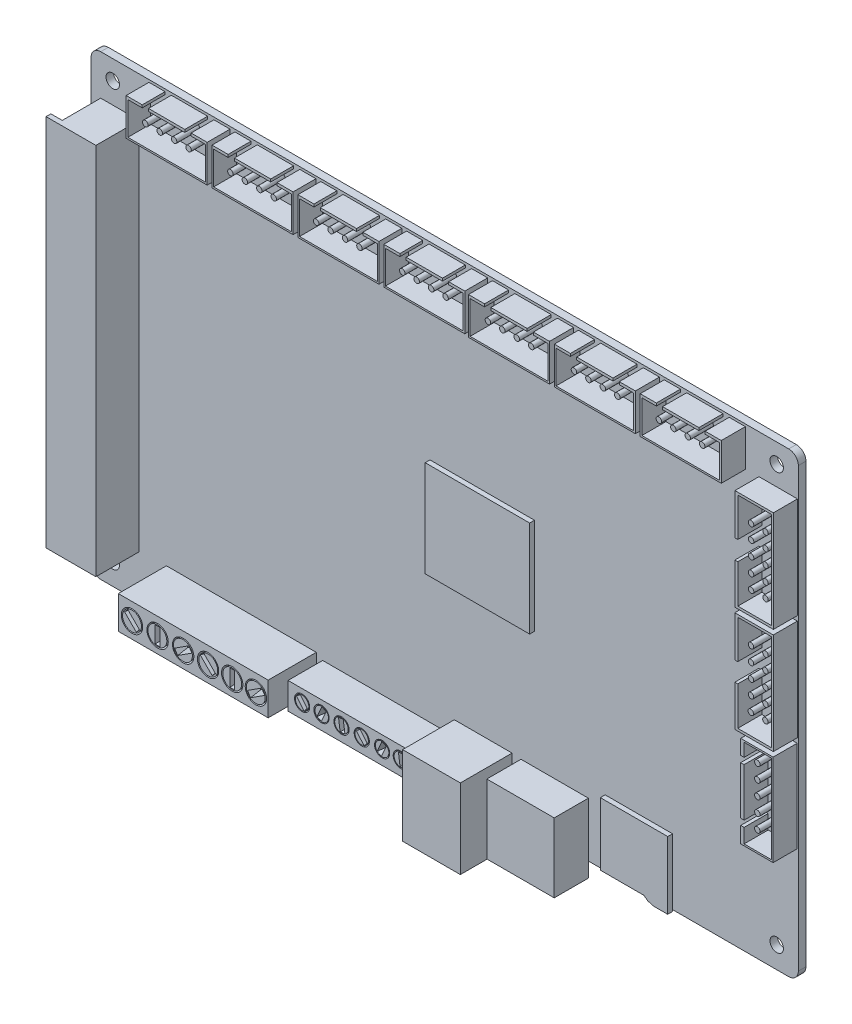
from build123d import *

# Parameters (mm, degrees)
SKETCH3_W                      = 147
SKETCH3_H                      = 95
BOSS_EXTRUDE5_DEPTH            = 1.5748
SKETCH6_R                      = 1.4
CUT_EXTRUDE2_DEPTH             = 1.5748
FILLET6_R                      = 2
SKETCH15_W                     = 21.714963211
SKETCH15_H                     = 19.996512885
BOSS_EXTRUDE10_DEPTH           = 1
SKETCH7_W                      = 12
SKETCH7_H                      = 16.5
BOSS_EXTRUDE6_DEPTH            = 10.75
CUT_EXTRUDE3_DEPTH             = 12
SKETCH9_W                      = 5.5
SKETCH9_H                      = 3.05
BOSS_EXTRUDE7_DEPTH            = 11
SKETCH10_W                     = 14
SKETCH10_H                     = 14.4
BOSS_EXTRUDE8_DEPTH            = 7.1
SKETCH13_W                     = 12.5
SKETCH13_H                     = 5.1
CUT_EXTRUDE4_DEPTH             = 13.1
SKETCH14_W                     = 12
SKETCH14_H                     = 2
BOSS_EXTRUDE9_DEPTH            = 13.1
BOSS_EXTRUDE12_DEPTH           = 1
SKETCH18_W                     = 8.78030315
SKETCH18_H                     = 0.653627585
CUT_EXTRUDE6_DEPTH             = 12
SKETCH20_W                     = 0.622617012
SKETCH20_H                     = 11.966823415
CUT_EXTRUDE10_DEPTH            = 4.2
SKETCH23_W                     = 1.026931474
SKETCH23_H                     = 0.632350711
CUT_EXTRUDE11_DEPTH            = 6.2
SKETCH24_W                     = 1.169082732
SKETCH24_H                     = 0.634351694
CUT_EXTRUDE12_DEPTH            = 7.2
SKETCH25_W                     = 2.917524703
SKETCH25_H                     = 0.634351694
CUT_EXTRUDE13_DEPTH            = 12.2
SKETCH26_W                     = 25.18883357
SKETCH26_H                     = 5.53344525
BOSS_EXTRUDE13_DEPTH           = 7.2
SKETCH27_R                     = 1.580289974
CUT_EXTRUDE15_DEPTH            = 6.2
SKETCH29_W                     = 3.626172381
SKETCH29_H                     = 3.322906905
SKETCH29_W_2                   = 3.774973003
SKETCH29_H_2                   = 3.265151783
SKETCH29_W_3                   = 3.635838499
SKETCH29_H_3                   = 3.35858141
SKETCH29_W_4                   = 3.688227309
SKETCH29_H_4                   = 3.334701193
SKETCH29_W_5                   = 3.579164331
SKETCH29_H_5                   = 3.348359628
SKETCH29_W_6                   = 3.488212318
SKETCH29_H_6                   = 3.383318186
CUT_EXTRUDE18_DEPTH            = 5.2
SKETCH39_R                     = 1.396144904
BOSS_EXTRUDE19_DEPTH           = 6
BOSS_EXTRUDE19_DRAFT           = -2
BOSS_EXTRUDE19_PROFILE_2_DEPTH = 6
BOSS_EXTRUDE19_PROFILE_2_DRAFT = -2
BOSS_EXTRUDE19_PROFILE_3_DEPTH = 6
BOSS_EXTRUDE19_PROFILE_3_DRAFT = -2
BOSS_EXTRUDE19_PROFILE_4_DEPTH = 6
BOSS_EXTRUDE19_PROFILE_4_DRAFT = -2
BOSS_EXTRUDE19_PROFILE_5_DEPTH = 6
BOSS_EXTRUDE19_PROFILE_5_DRAFT = -2
BOSS_EXTRUDE19_PROFILE_6_DEPTH = 6
BOSS_EXTRUDE19_PROFILE_6_DRAFT = -2
SKETCH89_W                     = 3.774973003
SKETCH89_H                     = 2.5316918
BOSS_EXTRUDE42_DEPTH           = 0.001
SKETCH89_W_2                   = 3.626172381
SKETCH89_H_2                   = 2.51724928
BOSS_EXTRUDE42_2_DEPTH         = 0.001
SKETCH89_W_3                   = 3.635838499
SKETCH89_H_3                   = 2.571403021
BOSS_EXTRUDE42_3_DEPTH         = 0.001
SKETCH89_W_4                   = 3.688227309
SKETCH89_H_4                   = 2.531798994
BOSS_EXTRUDE42_4_DEPTH         = 0.001
SKETCH89_W_5                   = 3.579164331
SKETCH89_H_5                   = 2.546927344
BOSS_EXTRUDE42_5_DEPTH         = 0.001
SKETCH89_W_6                   = 3.488212318
SKETCH89_H_6                   = 2.55763813
BOSS_EXTRUDE42_6_DEPTH         = 0.001
CUT_EXTRUDE45_DEPTH            = 2
CUT_EXTRUDE45_DRAFT            = -10
CUT_EXTRUDE45_PROFILE_2_DEPTH  = 2
CUT_EXTRUDE45_PROFILE_2_DRAFT  = -10
CUT_EXTRUDE45_PROFILE_3_DEPTH  = 2
CUT_EXTRUDE45_PROFILE_3_DRAFT  = -10
CUT_EXTRUDE45_PROFILE_4_DEPTH  = 2
CUT_EXTRUDE45_PROFILE_4_DRAFT  = -10
CUT_EXTRUDE45_PROFILE_5_DEPTH  = 2
CUT_EXTRUDE45_PROFILE_5_DRAFT  = -10
CUT_EXTRUDE45_PROFILE_6_DEPTH  = 2
CUT_EXTRUDE45_PROFILE_6_DRAFT  = -10
SKETCH32_W                     = 31.147399156
SKETCH32_H                     = 6.798527249
BOSS_EXTRUDE16_DEPTH           = 10
SKETCH36_R                     = 2.219312114
CUT_EXTRUDE19_DEPTH            = 6
SKETCH37_W                     = 4.373126017
SKETCH37_H                     = 4.272606052
SKETCH37_W_2                   = 4.373126018
SKETCH37_H_2                   = 4.272606053
CUT_EXTRUDE20_DEPTH            = 6
SKETCH38_R                     = 1.962451371
BOSS_EXTRUDE18_DEPTH           = 8.5
BOSS_EXTRUDE18_DRAFT           = -4
BOSS_EXTRUDE18_PROFILE_2_DEPTH = 8.5
BOSS_EXTRUDE18_PROFILE_2_DRAFT = -4
BOSS_EXTRUDE18_PROFILE_3_DEPTH = 8.5
BOSS_EXTRUDE18_PROFILE_3_DRAFT = -4
BOSS_EXTRUDE18_PROFILE_4_DEPTH = 8.5
BOSS_EXTRUDE18_PROFILE_4_DRAFT = -4
BOSS_EXTRUDE18_PROFILE_5_DEPTH = 8.5
BOSS_EXTRUDE18_PROFILE_5_DRAFT = -4
BOSS_EXTRUDE18_PROFILE_6_DEPTH = 8.5
BOSS_EXTRUDE18_PROFILE_6_DRAFT = -4
CUT_EXTRUDE44_DEPTH            = 2
CUT_EXTRUDE44_DRAFT            = -10
SKETCH86_W                     = 1
SKETCH86_H                     = 3.5
CUT_EXTRUDE44_PROFILE_2_DEPTH  = 2
CUT_EXTRUDE44_PROFILE_2_DRAFT  = -10
CUT_EXTRUDE44_PROFILE_3_DEPTH  = 2
CUT_EXTRUDE44_PROFILE_3_DRAFT  = -10
CUT_EXTRUDE44_PROFILE_4_DEPTH  = 2
CUT_EXTRUDE44_PROFILE_4_DRAFT  = -10
CUT_EXTRUDE44_PROFILE_5_DEPTH  = 2
CUT_EXTRUDE44_PROFILE_5_DRAFT  = -10
CUT_EXTRUDE44_PROFILE_6_DEPTH  = 2
CUT_EXTRUDE44_PROFILE_6_DRAFT  = -10
SKETCH87_W                     = 4.373126017
SKETCH87_H                     = 2.977794475
BOSS_EXTRUDE41_DEPTH           = 0.001
SKETCH87_W_2                   = 4.373126018
SKETCH87_H_2                   = 2.991745377
BOSS_EXTRUDE41_2_DEPTH         = 0.001
SKETCH87_H_3                   = 3.006004807
BOSS_EXTRUDE41_3_DEPTH         = 0.001
SKETCH87_H_4                   = 2.982931193
BOSS_EXTRUDE41_4_DEPTH         = 0.001
SKETCH87_W_3                   = 4.358644361
BOSS_EXTRUDE41_5_DEPTH         = 0.001
SKETCH87_H_5                   = 3.041534022
BOSS_EXTRUDE41_6_DEPTH         = 0.001
SKETCH40_W                     = 6.75
SKETCH40_H                     = 19
SKETCH40_W_2                   = 8
SKETCH40_H_2                   = 21
BOSS_EXTRUDE20_DEPTH           = 5
CUT_EXTRUDE24_DEPTH            = 5
SKETCH43_R                     = 0.569055362
BOSS_EXTRUDE23_DEPTH           = 4.75
SKETCH47_W                     = 16.85
SKETCH47_H                     = 7.7
BOSS_EXTRUDE25_DEPTH           = 5
CUT_EXTRUDE26_DEPTH            = 5
SKETCH50_R                     = 0.569055362
BOSS_EXTRUDE26_DEPTH           = 4.75
SKETCH51_W                     = 16.85
SKETCH51_H                     = 7.7
BOSS_EXTRUDE27_DEPTH           = 4.75
CUT_EXTRUDE28_DEPTH            = 4.75
SKETCH53_R                     = 0.569055362
BOSS_EXTRUDE28_DEPTH           = 4.75
SKETCH54_W                     = 16.85
SKETCH54_H                     = 7.7
BOSS_EXTRUDE29_DEPTH           = 4.75
CUT_EXTRUDE29_DEPTH            = 4.75
SKETCH56_R                     = 0.569055362
BOSS_EXTRUDE30_DEPTH           = 4.75
SKETCH60_W                     = 16.85
SKETCH60_H                     = 7.7
BOSS_EXTRUDE32_DEPTH           = 4.75
CUT_EXTRUDE30_DEPTH            = 4.75
SKETCH62_R                     = 0.569055362
BOSS_EXTRUDE33_DEPTH           = 4.75
SKETCH16_W                     = 8
SKETCH16_H                     = 77.642710186
BOSS_EXTRUDE11_DEPTH           = 8
SKETCH64_W                     = 4
SKETCH64_H                     = 8
SKETCH64_W_2                   = 4.033389406
SKETCH64_H_2                   = 8.142710186
SKETCH64_W_3                   = 4.042075951
CUT_EXTRUDE34_DEPTH            = 6.75
SKETCH65_R                     = 2.502700797
CUT_EXTRUDE35_DEPTH            = 3.75
BOSS_EXTRUDE40_DEPTH           = 5
BOSS_EXTRUDE40_DEPTH_BACK      = 1
SKETCH76_R                     = 2.566901317
SKETCH79_R                     = 3.232299172
CUT_EXTRUDE38_DEPTH            = 0.12
CUT_EXTRUDE43_DEPTH            = 2
CUT_EXTRUDE43_DRAFT            = -10
CUT_EXTRUDE43_PROFILE_2_DEPTH  = 2
CUT_EXTRUDE43_PROFILE_2_DRAFT  = -10
CUT_EXTRUDE43_PROFILE_3_DEPTH  = 2
CUT_EXTRUDE43_PROFILE_3_DRAFT  = -10
CUT_EXTRUDE43_PROFILE_4_DEPTH  = 2
CUT_EXTRUDE43_PROFILE_4_DRAFT  = -10
CUT_EXTRUDE43_PROFILE_5_DEPTH  = 2
CUT_EXTRUDE43_PROFILE_5_DRAFT  = -10
CUT_EXTRUDE43_PROFILE_6_DEPTH  = 2
CUT_EXTRUDE43_PROFILE_6_DRAFT  = -10
CUT_EXTRUDE43_PROFILE_7_DEPTH  = 2
CUT_EXTRUDE43_PROFILE_7_DRAFT  = -10
CUT_EXTRUDE43_PROFILE_8_DEPTH  = 2
CUT_EXTRUDE43_PROFILE_8_DRAFT  = -10
SKETCH67_W                     = 10.35593763
SKETCH67_H                     = 77.642710186
BOSS_EXTRUDE35_DEPTH           = 1


with BuildPart() as part:
    # Sketch3 → Boss-Extrude5 (new body)
    with BuildSketch(Plane.XY):
        with Locations((17.207803993, -3.613430127)):
            Rectangle(SKETCH3_W, SKETCH3_H)
    extrude(amount=BOSS_EXTRUDE5_DEPTH)

    # Sketch6 → Cut-Extrude2 (cut)
    with BuildSketch(Plane.XY.offset(1.5748)):
        with Locations((-51.792196007, -46.613430127)):
            Circle(SKETCH6_R)
        with Locations((-51.792196007, 39.886569873)):
            Circle(SKETCH6_R)
        with Locations((86.207803993, -46.613430127)):
            Circle(SKETCH6_R)
        with Locations((86.207803993, 39.886569873)):
            Circle(SKETCH6_R)
    extrude(amount=-CUT_EXTRUDE2_DEPTH, mode=Mode.SUBTRACT)

    # Fillet6
    fillet6_edges = [part.edges().sort_by_distance(p)[0] for p in [
        (-56.292196007, -51.113430127, 0.7874),
        (90.707803993, -51.113430127, 0.7874),
        (-56.292196007, 43.886569873, 0.7874),
        (90.707803993, 43.886569873, 0.7874),
    ]]
    fillet(fillet6_edges, radius=FILLET6_R)

    # Sketch15 → Boss-Extrude10 (add)
    with BuildSketch(Plane.XY.offset(1.5748)):
        with Locations((25.005222369, -5.372433472)):
            Rectangle(SKETCH15_W, SKETCH15_H)
    extrude(amount=BOSS_EXTRUDE10_DEPTH)

    # Sketch7 → Boss-Extrude6 (add)
    with BuildSketch(Plane.XY.offset(1.5748)):
        with Locations((25.207803993, -47.863430127)):
            Rectangle(SKETCH7_W, SKETCH7_H)
    extrude(amount=BOSS_EXTRUDE6_DEPTH)

    # Sketch8 → Cut-Extrude3 (cut)
    with BuildSketch(Plane(origin=(0, -56.113430127, 0), x_dir=(-1, 0, 0), z_dir=(0, -1, 0))):
        Polygon((-22.341878039, -10.675127707), (-27.841878039, -10.675127707), (-29.237343222, -9.201082582), (-29.237343222, -2.895127707), (-20.787343222, -2.895127707), (-20.787343222, -9.20346366), align=None)
    extrude(amount=-CUT_EXTRUDE3_DEPTH, mode=Mode.SUBTRACT)

    # Sketch9 → Boss-Extrude7 (add)
    with BuildSketch(Plane(origin=(0, -44.113430127, 0), x_dir=(-1, 0, 0), z_dir=(0, -1, 0))):
        with Locations((-25.054619289, -6.996187842)):
            Rectangle(SKETCH9_W, SKETCH9_H)
    extrude(amount=BOSS_EXTRUDE7_DEPTH)

    # Sketch10 → Boss-Extrude8 (add)
    with BuildSketch(Plane.XY.offset(1.5748)):
        with Locations((40.064382528, -47.001183299)):
            Rectangle(SKETCH10_W, SKETCH10_H)
    extrude(amount=BOSS_EXTRUDE8_DEPTH)

    # Sketch13 → Cut-Extrude4 (cut)
    with BuildSketch(Plane.XZ.offset(54.201183299)):
        with Locations((40.050984638, 5.17150284)):
            Rectangle(SKETCH13_W, SKETCH13_H)
    extrude(amount=-CUT_EXTRUDE4_DEPTH, mode=Mode.SUBTRACT)

    # Sketch14 → Boss-Extrude9 (add)
    with BuildSketch(Plane.XZ.offset(41.101183299)):
        with Locations((40.088527908, 6.334955429)):
            Rectangle(SKETCH14_W, SKETCH14_H)
    extrude(amount=BOSS_EXTRUDE9_DEPTH)

    # Sketch17 → Boss-Extrude12 (add)
    with BuildSketch(Plane.XY.offset(1.5748)):
        Polygon((50.552999348, -50.518775734), (59.58823747, -50.518775734), (60.425479613, -51.113430127), (61.54180247, -51.460673144), (64.552999348, -51.460673144), (64.552999348, -37.460673144), (50.552999348, -37.460673144), align=None)
    extrude(amount=BOSS_EXTRUDE12_DEPTH)

    # Sketch18 → Cut-Extrude6 (cut)
    with BuildSketch(Plane(origin=(0, -50.518775734, 0), x_dir=(-1, 0, 0), z_dir=(0, -1, 0))):
        with Locations((-55.211638628, -2.067742869)):
            Rectangle(SKETCH18_W, SKETCH18_H)
    extrude(amount=-CUT_EXTRUDE6_DEPTH, mode=Mode.SUBTRACT)

    # Sketch20 → Cut-Extrude10 (cut)
    with BuildSketch(Plane.ZY.offset(-59.601790203)):
        with Locations((2.052237583, -44.535364027)):
            Rectangle(SKETCH20_W, SKETCH20_H)
    extrude(amount=-CUT_EXTRUDE10_DEPTH, mode=Mode.SUBTRACT)

    # Sketch23 → Cut-Extrude11 (cut)
    with BuildSketch(Plane(origin=(-3.869323142, -5.447803689, 0), x_dir=(0.8152853073521378, -0.5790594681168164, 0), z_dir=(-0.5790594681168164, -0.8152853073521378, 0))):
        with Locations((78.348255644, 2.073270127)):
            Rectangle(SKETCH23_W, SKETCH23_H)
    extrude(amount=-CUT_EXTRUDE11_DEPTH, mode=Mode.SUBTRACT)

    # Sketch24 → Cut-Extrude12 (cut)
    with BuildSketch(Plane(origin=(-9.165804948, -29.466388259, 0), x_dir=(0.9548707089079665, -0.2970217656495859, 0), z_dir=(-0.2970217656495858, -0.9548707089079664, 0))):
        with Locations((73.464863185, 2.072269635)):
            Rectangle(SKETCH24_W, SKETCH24_H)
    extrude(amount=-CUT_EXTRUDE12_DEPTH, mode=Mode.SUBTRACT)

    # Sketch25 → Cut-Extrude13 (cut)
    with BuildSketch(Plane.XZ.offset(51.460673144)):
        with Locations((63.000564822, 2.072269635)):
            Rectangle(SKETCH25_W, SKETCH25_H)
    extrude(amount=-CUT_EXTRUDE13_DEPTH, mode=Mode.SUBTRACT)

    # Sketch26 → Boss-Extrude13 (add)
    with BuildSketch(Plane.XY.offset(1.5748)):
        with Locations((4.436304208, -45.387474064)):
            Rectangle(SKETCH26_W, SKETCH26_H)
    extrude(amount=BOSS_EXTRUDE13_DEPTH)

    # Sketch27 → Cut-Extrude15 (cut)
    with BuildSketch(Plane.XY.offset(8.7748)):
        with Locations((-5.236205188, -45.180630643)):
            Circle(SKETCH27_R)
        with Locations((-1.203182391, -45.180630643)):
            Circle(SKETCH27_R)
        with Locations((2.957002854, -45.180630643)):
            Circle(SKETCH27_R)
        with Locations((7.166828426, -45.190844618)):
            Circle(SKETCH27_R)
        with Locations((11.399958297, -45.190844618)):
            Circle(SKETCH27_R)
        with Locations((15.27910638, -45.190844618)):
            Circle(SKETCH27_R)
    extrude(amount=-CUT_EXTRUDE15_DEPTH, mode=Mode.SUBTRACT)

    # Sketch29 → Cut-Extrude18 (cut)
    with BuildSketch(Plane.XZ.offset(48.154196689)):
        with Locations((-1.673951032, 3.494852441)):
            Rectangle(SKETCH29_W, SKETCH29_H)
        with Locations((-5.802030786, 3.538172521)):
            Rectangle(SKETCH29_W_2, SKETCH29_H_2)
        with Locations((2.589908451, 3.531168929)):
            Rectangle(SKETCH29_W_3, SKETCH29_H_3)
        with Locations((6.944386417, 3.503505011)):
            Rectangle(SKETCH29_W_4, SKETCH29_H_4)
        with Locations((11.177948065, 3.517806704)):
            Rectangle(SKETCH29_W_5, SKETCH29_H_5)
        with Locations((15.133000232, 3.511038211)):
            Rectangle(SKETCH29_W_6, SKETCH29_H_6)
    extrude(amount=-CUT_EXTRUDE18_DEPTH, mode=Mode.SUBTRACT)

    # Sketch32 → Boss-Extrude16 (add)
    with BuildSketch(Plane.XY.offset(1.5748)):
        with Locations((-25.060982713, -45.224644901)):
            Rectangle(SKETCH32_W, SKETCH32_H)
    extrude(amount=BOSS_EXTRUDE16_DEPTH)

    # Sketch36 → Cut-Extrude19 (cut)
    with BuildSketch(Plane.XY.offset(11.5748)):
        with Locations((-37.786945298, -45.340307317)):
            Circle(SKETCH36_R)
        with Locations((-32.4689198, -45.340307317)):
            Circle(SKETCH36_R)
        with Locations((-27.155319172, -45.340307317)):
            Circle(SKETCH36_R)
        with Locations((-21.980139946, -45.340307317)):
            Circle(SKETCH36_R)
        with Locations((-16.966134997, -45.340307317)):
            Circle(SKETCH36_R)
        with Locations((-12.037559721, -45.340307317)):
            Circle(SKETCH36_R)
    extrude(amount=-CUT_EXTRUDE19_DEPTH, mode=Mode.SUBTRACT)

    # Sketch37 → Cut-Extrude20 (cut)
    with BuildSketch(Plane.XZ.offset(48.623908526)):
        with Locations((-38.038169002, 4.127758815)):
            Rectangle(SKETCH37_W, SKETCH37_H)
        with Locations((-32.509514199, 4.141709717)):
            Rectangle(SKETCH37_W_2, SKETCH37_H_2)
        with Locations((-27.273667393, 4.155969147)):
            Rectangle(SKETCH37_W, SKETCH37_H_2)
        with Locations((-22.108498903, 4.132895533)):
            Rectangle(SKETCH37_W_2, SKETCH37_H)
        with Locations((-17.022603907, 4.180710001)):
            Rectangle(SKETCH37_W, SKETCH37_H_2)
        with Locations((-12.085754086, 4.191498361)):
            Rectangle(SKETCH37_W, SKETCH37_H_2)
    extrude(amount=-CUT_EXTRUDE20_DEPTH, mode=Mode.SUBTRACT)

    # Sketch40 → Boss-Extrude20 (add)
    with BuildSketch(Plane.XY.offset(1.5748)):
        with Locations((87.096852091, -17.70353017)):
            Rectangle(SKETCH40_W, SKETCH40_H)
        with Locations((86.501077821, 3.29646983)):
            Rectangle(SKETCH40_W_2, SKETCH40_H_2)
        with Locations((86.522761757, 25.29646983)):
            Rectangle(SKETCH40_W_2, SKETCH40_H_2)
    extrude(amount=BOSS_EXTRUDE20_DEPTH)

    # Sketch41 → Cut-Extrude24 (cut)
    with BuildSketch(Plane.XY.offset(6.5748)):
        Polygon((83.129429206, 23.29646983), (83.129429206, 15.29646983), (90.172761757, 15.29646983), (90.172761757, 35.29646983), (83.129429206, 35.29646983), (83.129429206, 27.29646983), (82.522761757, 27.29646983), (82.522761757, 23.29646983), align=None)
        Polygon((83.115428928, 1.29646983), (83.115428928, -6.70353017), (90.151077821, -6.70353017), (90.151077821, 13.29646983), (83.115428928, 13.29646983), (83.115428928, 5.29646983), (82.501077821, 5.29646983), (82.501077821, 1.29646983), align=None)
        Polygon((84.429811691, -23.876456255), (84.429811691, -26.85353017), (90.121852091, -26.85353017), (90.121852091, -8.55353017), (84.429811691, -8.55353017), (84.429811691, -11.276456255), (83.721852091, -11.276456255), (83.721852091, -12.576456255), (84.429811691, -12.576456255), (84.429811691, -22.576456255), (83.721852091, -22.576456255), (83.721852091, -23.876456255), align=None)
    extrude(amount=-CUT_EXTRUDE24_DEPTH, mode=Mode.SUBTRACT)

    # Sketch43 → Boss-Extrude23 (add)
    with BuildSketch(Plane.XY.offset(1.5748)):
        with Locations((86.929811691, -23.187850823)):
            Circle(SKETCH43_R)
        with Locations((86.929811691, -20.187850823)):
            Circle(SKETCH43_R)
        with Locations((86.929811691, -14.187850823)):
            Circle(SKETCH43_R)
        with Locations((86.929811691, -17.187850823)):
            Circle(SKETCH43_R)
        with Locations((86.929811691, -11.187850823)):
            Circle(SKETCH43_R)
        with Locations((85.571686069, -2.70353017)):
            Circle(SKETCH43_R)
        with Locations((85.615428928, 0.29646983)):
            Circle(SKETCH43_R)
        with Locations((85.615428928, 6.29646983)):
            Circle(SKETCH43_R)
        with Locations((85.615428928, 3.29646983)):
            Circle(SKETCH43_R)
        with Locations((85.615428928, 9.29646983)):
            Circle(SKETCH43_R)
        with Locations((88.615428928, -2.70353017)):
            Circle(SKETCH43_R)
        with Locations((88.615428928, 0.29646983)):
            Circle(SKETCH43_R)
        with Locations((88.615428928, 6.29646983)):
            Circle(SKETCH43_R)
        with Locations((88.615428928, 3.29646983)):
            Circle(SKETCH43_R)
        with Locations((88.615428928, 9.29646983)):
            Circle(SKETCH43_R)
        with Locations((85.629429206, 19.29646983)):
            Circle(SKETCH43_R)
        with Locations((85.629429206, 22.29646983)):
            Circle(SKETCH43_R)
        with Locations((85.629429206, 28.29646983)):
            Circle(SKETCH43_R)
        with Locations((85.629429206, 25.322432956)):
            Circle(SKETCH43_R)
        with Locations((85.629429206, 31.29646983)):
            Circle(SKETCH43_R)
        with Locations((88.629429206, 19.29646983)):
            Circle(SKETCH43_R)
        with Locations((88.629429206, 22.29646983)):
            Circle(SKETCH43_R)
        with Locations((88.629429206, 28.29646983)):
            Circle(SKETCH43_R)
        with Locations((88.629429206, 25.29646983)):
            Circle(SKETCH43_R)
        with Locations((88.629429206, 31.29646983)):
            Circle(SKETCH43_R)
    extrude(amount=BOSS_EXTRUDE23_DEPTH)

    # Sketch47 → Boss-Extrude25 (add)
    with BuildSketch(Plane.XY.offset(1.5748)):
        with Locations((53.412979373, 39.536569873)):
            Rectangle(SKETCH47_W, SKETCH47_H)
        with Locations((35.562979373, 39.536569873)):
            Rectangle(SKETCH47_W, SKETCH47_H)
        with Locations((71.262979373, 39.536569873)):
            Rectangle(SKETCH47_W, SKETCH47_H)
    extrude(amount=BOSS_EXTRUDE25_DEPTH)

    # Sketch48 → Cut-Extrude26 (cut)
    with BuildSketch(Plane.XY.offset(6.5748)):
        Polygon((27.487979373, 36.036569873), (43.637979373, 36.036569873), (43.637979373, 42.836569873), (40.637979373, 42.836569873), (40.637979373, 43.386569873), (39.337979373, 43.386569873), (39.337979373, 42.836569873), (31.787979373, 42.836569873), (31.787979373, 43.386569873), (30.487979373, 43.386569873), (30.487979373, 42.836569873), (27.487979373, 42.836569873), align=None)
        Polygon((45.337979373, 36.036569873), (61.487979373, 36.036569873), (61.487979373, 42.836569873), (58.487979373, 42.836569873), (58.487979373, 43.386569873), (57.187979373, 43.386569873), (57.187979373, 42.836569873), (49.637979373, 42.836569873), (49.637979373, 43.386569873), (48.337979373, 43.386569873), (48.337979373, 42.836569873), (45.337979373, 42.836569873), align=None)
        Polygon((63.189047262, 36.036569873), (79.337979373, 36.036569873), (79.337979373, 42.836569873), (76.337979373, 42.836569873), (76.337979373, 43.386569873), (75.037979373, 43.386569873), (75.037979373, 42.836569873), (67.489047262, 42.836569873), (67.489047262, 43.386569873), (66.189047262, 43.386569873), (66.189047262, 42.836569873), (63.189047262, 42.836569873), align=None)
    extrude(amount=-CUT_EXTRUDE26_DEPTH, mode=Mode.SUBTRACT)

    # Sketch50 → Boss-Extrude26 (add)
    with BuildSketch(Plane.XY.offset(1.5748)):
        with Locations((69.466938241, 40.336869119)):
            Circle(SKETCH50_R)
        with Locations((66.466938256, 40.337168365)):
            Circle(SKETCH50_R)
        with Locations((72.466938226, 40.336569873)):
            Circle(SKETCH50_R)
        with Locations((75.466938226, 40.337707496)):
            Circle(SKETCH50_R)
        with Locations((51.819227733, 40.336569873)):
            Circle(SKETCH50_R)
        with Locations((48.819227733, 40.336569873)):
            Circle(SKETCH50_R)
        with Locations((54.819227733, 40.336569873)):
            Circle(SKETCH50_R)
        with Locations((57.819227733, 40.336569873)):
            Circle(SKETCH50_R)
        with Locations((33.926238974, 40.336569873)):
            Circle(SKETCH50_R)
        with Locations((30.926238974, 40.336569873)):
            Circle(SKETCH50_R)
        with Locations((36.926238974, 40.336569873)):
            Circle(SKETCH50_R)
        with Locations((39.926238974, 40.336569873)):
            Circle(SKETCH50_R)
    extrude(amount=BOSS_EXTRUDE26_DEPTH)

    # Sketch51 → Boss-Extrude27 (add)
    with BuildSketch(Plane.XY.offset(1.5748)):
        with Locations((-0.137020627, 39.536569873)):
            Rectangle(SKETCH51_W, SKETCH51_H)
        with Locations((17.712979373, 39.536569873)):
            Rectangle(SKETCH51_W, SKETCH51_H)
    extrude(amount=BOSS_EXTRUDE27_DEPTH)

    # Sketch52 → Cut-Extrude28 (cut)
    with BuildSketch(Plane.XY.offset(6.3248)):
        Polygon((-8.212020627, 36.036569873), (7.937979373, 36.036569873), (7.937979373, 42.836569873), (4.937979373, 42.836569873), (4.937979373, 43.386569873), (3.637979373, 43.386569873), (3.637979373, 42.836569873), (-3.912020627, 42.836569873), (-3.912020627, 43.386569873), (-5.212020627, 43.386569873), (-5.212020627, 42.836569873), (-8.212020627, 42.836569873), align=None)
        Polygon((9.637979373, 36.036569873), (25.786911483, 36.036569873), (25.786911483, 42.836569873), (22.786911483, 42.836569873), (22.786911483, 43.489712014), (21.486911483, 43.489712014), (21.486911483, 42.836569873), (13.937979373, 42.836569873), (13.937979373, 43.489712014), (12.637979373, 43.489712014), (12.637979373, 42.836569873), (9.637979373, 42.836569873), align=None)
    extrude(amount=-CUT_EXTRUDE28_DEPTH, mode=Mode.SUBTRACT)

    # Sketch53 → Boss-Extrude28 (add)
    with BuildSketch(Plane.XY.offset(1.5748)):
        with Locations((16.130464152, 40.336569873)):
            Circle(SKETCH53_R)
        with Locations((13.130464152, 40.336569873)):
            Circle(SKETCH53_R)
        with Locations((19.130464152, 40.336569873)):
            Circle(SKETCH53_R)
        with Locations((22.130464152, 40.336569873)):
            Circle(SKETCH53_R)
        with Locations((-1.762524607, 40.336569873)):
            Circle(SKETCH53_R)
        with Locations((-4.762524607, 40.336569873)):
            Circle(SKETCH53_R)
        with Locations((1.237475393, 40.336569873)):
            Circle(SKETCH53_R)
        with Locations((4.237475393, 40.336569873)):
            Circle(SKETCH53_R)
    extrude(amount=BOSS_EXTRUDE28_DEPTH)

    # Sketch54 → Boss-Extrude29 (add)
    with BuildSketch(Plane.XY.offset(1.5748)):
        with Locations((-17.987020627, 39.536569873)):
            Rectangle(SKETCH54_W, SKETCH54_H)
    extrude(amount=BOSS_EXTRUDE29_DEPTH)

    # Sketch55 → Cut-Extrude29 (cut)
    with BuildSketch(Plane.XY.offset(6.3248)):
        Polygon((-26.062020627, 36.036569873), (-9.912020627, 36.036569873), (-9.912020627, 42.836569873), (-12.912020627, 42.836569873), (-12.912020627, 43.386569873), (-14.212020627, 43.386569873), (-14.212020627, 42.836569873), (-21.762020627, 42.836569873), (-21.762020627, 43.386569873), (-23.062020627, 43.386569873), (-23.062020627, 42.836569873), (-26.062020627, 42.836569873), align=None)
    extrude(amount=-CUT_EXTRUDE29_DEPTH, mode=Mode.SUBTRACT)

    # Sketch56 → Boss-Extrude30 (add)
    with BuildSketch(Plane.XY.offset(1.5748)):
        with Locations((-19.580399491, 40.336569873)):
            Circle(SKETCH56_R)
        with Locations((-22.580399491, 40.336569873)):
            Circle(SKETCH56_R)
        with Locations((-16.580399491, 40.336569873)):
            Circle(SKETCH56_R)
        with Locations((-13.580399491, 40.336569873)):
            Circle(SKETCH56_R)
    extrude(amount=BOSS_EXTRUDE30_DEPTH)

    # Sketch60 → Boss-Extrude32 (add)
    with BuildSketch(Plane.XY.offset(1.5748)):
        with Locations((-35.837020627, 39.536569873)):
            Rectangle(SKETCH60_W, SKETCH60_H)
    extrude(amount=BOSS_EXTRUDE32_DEPTH)

    # Sketch61 → Cut-Extrude30 (cut)
    with BuildSketch(Plane.XY.offset(6.3248)):
        Polygon((-43.912020627, 36.036569873), (-27.762020627, 36.036569873), (-27.762020627, 42.836569873), (-30.762020627, 42.836569873), (-30.762020627, 43.386569873), (-32.062020627, 43.386569873), (-32.062020627, 42.836569873), (-39.612020627, 42.836569873), (-39.612020627, 43.386569873), (-40.912020627, 43.386569873), (-40.912020627, 42.836569873), (-43.912020627, 42.836569873), align=None)
    extrude(amount=-CUT_EXTRUDE30_DEPTH, mode=Mode.SUBTRACT)

    # Sketch62 → Boss-Extrude33 (add)
    with BuildSketch(Plane.XY.offset(1.5748)):
        with Locations((-37.281131474, 40.336569873)):
            Circle(SKETCH62_R)
        with Locations((-40.281131474, 40.336569873)):
            Circle(SKETCH62_R)
        with Locations((-34.281131474, 40.336569873)):
            Circle(SKETCH62_R)
        with Locations((-31.281131474, 40.336569873)):
            Circle(SKETCH62_R)
    extrude(amount=BOSS_EXTRUDE33_DEPTH)

    # Sketch16 → Boss-Extrude11 (add)
    with BuildSketch(Plane.XY.offset(1.5748)):
        with Locations((-50.292196007, -3.301420503)):
            Rectangle(SKETCH16_W, SKETCH16_H)
    extrude(amount=BOSS_EXTRUDE11_DEPTH)

    # Sketch64 → Cut-Extrude34 (cut)
    with BuildSketch(Plane.ZY.offset(54.292196007)):
        with Locations((7.5748, 30.01993459)):
            Rectangle(SKETCH64_W, SKETCH64_H)
        with Locations((7.5748, 20.51993459)):
            Rectangle(SKETCH64_W, SKETCH64_H)
        with Locations((7.5748, 11.01993459)):
            Rectangle(SKETCH64_W, SKETCH64_H)
        with Locations((7.5748, 1.51993459)):
            Rectangle(SKETCH64_W, SKETCH64_H)
        with Locations((7.5748, -7.98006541)):
            Rectangle(SKETCH64_W, SKETCH64_H)
        with Locations((7.558105297, -27.051420503)):
            Rectangle(SKETCH64_W_2, SKETCH64_H_2)
        with Locations((7.5748, -17.48006541)):
            Rectangle(SKETCH64_W, SKETCH64_H)
        with Locations((7.553762025, -36.622775596)):
            Rectangle(SKETCH64_W_3, SKETCH64_H)
    extrude(amount=-CUT_EXTRUDE34_DEPTH, mode=Mode.SUBTRACT)

    # Sketch65 → Cut-Extrude35 (cut)
    with BuildSketch(Plane.XY.offset(5.5748)):
        with Locations((-50.888201122, 30.025480468)):
            Circle(SKETCH65_R)
        with Locations((-50.917196007, 20.51993459)):
            Circle(SKETCH65_R)
        with Locations((-50.917196007, 11.01993459)):
            Circle(SKETCH65_R)
        with Locations((-50.917196007, 1.51993459)):
            Circle(SKETCH65_R)
        with Locations((-50.917196007, -7.98006541)):
            Circle(SKETCH65_R)
        with Locations((-50.917196007, -17.48006541)):
            Circle(SKETCH65_R)
        with Locations((-50.945882935, -26.8958285)):
            Circle(SKETCH65_R)
        with Locations((-50.917196007, -36.602495549)):
            Circle(SKETCH65_R)
    extrude(amount=-CUT_EXTRUDE35_DEPTH, mode=Mode.SUBTRACT)

    # Sketch76 → Boss-Extrude40 (add, two sides: drawn at the far end of the back side and taken through both)
    with BuildSketch(Plane.XY.offset(1.8248).offset(-BOSS_EXTRUDE40_DEPTH_BACK)):
        with Locations((-51.030437086, 20.456489521)):
            Circle(SKETCH76_R)
        with Locations((-51.030437086, 29.951544237)):
            Circle(SKETCH76_R)
        with Locations((-51.030437086, 11.142721318)):
            Circle(SKETCH76_R)
        with Locations((-50.917196007, 1.51993459)):
            Circle(SKETCH76_R)
        with Locations((-50.917196007, -7.935369871)):
            Circle(SKETCH76_R)
        with Locations((-50.945882935, -17.414738342)):
            Circle(SKETCH76_R)
        with Locations((-50.945882935, -26.8958285)):
            Circle(SKETCH76_R)
        with Locations((-50.917196007, -36.602495549)):
            Circle(SKETCH76_R)
    extrude(amount=BOSS_EXTRUDE40_DEPTH + BOSS_EXTRUDE40_DEPTH_BACK)

    # Sketch79 → Cut-Extrude38 (cut)
    with BuildSketch(Plane.XY.offset(5.5748)):
        with Locations((-50.879896867, 20.467643773)):
            Circle(SKETCH79_R)
        with Locations((-50.849079855, 29.974418889)):
            Circle(SKETCH79_R)
        with Locations((-50.879896867, 11.284641479)):
            Circle(SKETCH79_R)
        with Locations((-50.8958665, 1.545637911)):
            Circle(SKETCH79_R)
        with Locations((-50.817068655, -7.901236898)):
            Circle(SKETCH79_R)
        with Locations((-50.82040226, -17.398306067)):
            Circle(SKETCH79_R)
        with Locations((-50.792196317, -26.805946795)):
            Circle(SKETCH79_R)
        with Locations((-51.067841233, -36.516131082)):
            Circle(SKETCH79_R)
    extrude(amount=CUT_EXTRUDE38_DEPTH, mode=Mode.SUBTRACT)


with BuildPart() as body_2:
    # Sketch39 → Boss-Extrude19 (with draft: the straight prism first)
    with BuildSketch(Plane.XY.offset(8.7748)):
        with Locations((-5.236205188, -45.180630643)):
            Circle(SKETCH39_R)
    extrude(amount=-BOSS_EXTRUDE19_DEPTH)
    # Boss-Extrude19: the draft: its side faces are tilted about the plane it starts from
    boss_extrude19_sides = [body_2.faces().sort_by_distance(p)[0] for p in [
        (-6.632350093, -45.180630643, 5.7748),
    ]]
    draft(boss_extrude19_sides, Plane.XY.offset(8.7748), BOSS_EXTRUDE19_DRAFT)


with BuildPart() as body_3:
    # Sketch39 → Boss-Extrude19 profile 2 (with draft: the straight prism first)
    with BuildSketch(Plane.XY.offset(8.7748)):
        with Locations((-1.159265502, -45.180630643)):
            Circle(SKETCH39_R)
    extrude(amount=-BOSS_EXTRUDE19_PROFILE_2_DEPTH)
    # Boss-Extrude19 profile 2: the draft: its side faces are tilted about the plane it starts from
    boss_extrude19_profile_2_sides = [body_3.faces().sort_by_distance(p)[0] for p in [
        (-2.555410406, -45.180630643, 5.7748),
    ]]
    draft(boss_extrude19_profile_2_sides, Plane.XY.offset(8.7748), BOSS_EXTRUDE19_PROFILE_2_DRAFT)


with BuildPart() as body_4:
    # Sketch39 → Boss-Extrude19 profile 3 (with draft: the straight prism first)
    with BuildSketch(Plane.XY.offset(8.7748)):
        with Locations((2.941479821, -45.180630643)):
            Circle(SKETCH39_R)
    extrude(amount=-BOSS_EXTRUDE19_PROFILE_3_DEPTH)
    # Boss-Extrude19 profile 3: the draft: its side faces are tilted about the plane it starts from
    boss_extrude19_profile_3_sides = [body_4.faces().sort_by_distance(p)[0] for p in [
        (1.545334917, -45.180630643, 5.7748),
    ]]
    draft(boss_extrude19_profile_3_sides, Plane.XY.offset(8.7748), BOSS_EXTRUDE19_PROFILE_3_DRAFT)


with BuildPart() as body_5:
    # Sketch39 → Boss-Extrude19 profile 4 (with draft: the straight prism first)
    with BuildSketch(Plane.XY.offset(8.7748)):
        with Locations((7.149512166, -45.180630643)):
            Circle(SKETCH39_R)
    extrude(amount=-BOSS_EXTRUDE19_PROFILE_4_DEPTH)
    # Boss-Extrude19 profile 4: the draft: its side faces are tilted about the plane it starts from
    boss_extrude19_profile_4_sides = [body_5.faces().sort_by_distance(p)[0] for p in [
        (5.753367261, -45.180630643, 5.7748),
    ]]
    draft(boss_extrude19_profile_4_sides, Plane.XY.offset(8.7748), BOSS_EXTRUDE19_PROFILE_4_DRAFT)


with BuildPart() as body_6:
    # Sketch39 → Boss-Extrude19 profile 5 (with draft: the straight prism first)
    with BuildSketch(Plane.XY.offset(8.7748)):
        with Locations((11.402389847, -45.180630643)):
            Circle(SKETCH39_R)
    extrude(amount=-BOSS_EXTRUDE19_PROFILE_5_DEPTH)
    # Boss-Extrude19 profile 5: the draft: its side faces are tilted about the plane it starts from
    boss_extrude19_profile_5_sides = [body_6.faces().sort_by_distance(p)[0] for p in [
        (10.006244943, -45.180630643, 5.7748),
    ]]
    draft(boss_extrude19_profile_5_sides, Plane.XY.offset(8.7748), BOSS_EXTRUDE19_PROFILE_5_DRAFT)


with BuildPart() as body_7:
    # Sketch39 → Boss-Extrude19 profile 6 (with draft: the straight prism first)
    with BuildSketch(Plane.XY.offset(8.7748)):
        with Locations((15.290689545, -45.180630643)):
            Circle(SKETCH39_R)
    extrude(amount=-BOSS_EXTRUDE19_PROFILE_6_DEPTH)
    # Boss-Extrude19 profile 6: the draft: its side faces are tilted about the plane it starts from
    boss_extrude19_profile_6_sides = [body_7.faces().sort_by_distance(p)[0] for p in [
        (13.894544641, -45.180630643, 5.7748),
    ]]
    draft(boss_extrude19_profile_6_sides, Plane.XY.offset(8.7748), BOSS_EXTRUDE19_PROFILE_6_DRAFT)


with BuildPart() as body_8:
    # Sketch89 → Boss-Extrude42 (new body)
    with BuildSketch(Plane.XZ.offset(48.154196689)):
        with Locations((-5.802030786, 3.904902513)):
            Rectangle(SKETCH89_W, SKETCH89_H)
    extrude(amount=BOSS_EXTRUDE42_DEPTH)


with BuildPart() as body_9:
    # Sketch89 → Boss-Extrude42 2 (new body)
    with BuildSketch(Plane.XZ.offset(48.154196689)):
        with Locations((-1.673951032, 3.897681253)):
            Rectangle(SKETCH89_W_2, SKETCH89_H_2)
    extrude(amount=BOSS_EXTRUDE42_2_DEPTH)


with BuildPart() as body_10:
    # Sketch89 → Boss-Extrude42 3 (new body)
    with BuildSketch(Plane.XZ.offset(48.154196689)):
        with Locations((2.589908451, 3.924758124)):
            Rectangle(SKETCH89_W_3, SKETCH89_H_3)
    extrude(amount=BOSS_EXTRUDE42_3_DEPTH)


with BuildPart() as body_11:
    # Sketch89 → Boss-Extrude42 4 (new body)
    with BuildSketch(Plane.XZ.offset(48.154196689)):
        with Locations((6.944386417, 3.90495611)):
            Rectangle(SKETCH89_W_4, SKETCH89_H_4)
    extrude(amount=BOSS_EXTRUDE42_4_DEPTH)


with BuildPart() as body_12:
    # Sketch89 → Boss-Extrude42 5 (new body)
    with BuildSketch(Plane.XZ.offset(48.154196689)):
        with Locations((11.177948065, 3.918522846)):
            Rectangle(SKETCH89_W_5, SKETCH89_H_5)
    extrude(amount=BOSS_EXTRUDE42_5_DEPTH)


with BuildPart() as body_13:
    # Sketch89 → Boss-Extrude42 6 (new body)
    with BuildSketch(Plane.XZ.offset(48.154196689)):
        with Locations((15.133000232, 3.923878239)):
            Rectangle(SKETCH89_W_6, SKETCH89_H_6)
    extrude(amount=BOSS_EXTRUDE42_6_DEPTH)


with BuildPart() as cut_extrude45_tool:
    # Sketch88 → Cut-Extrude45 (with draft: the straight prism first)
    with BuildSketch(Plane.XY.offset(8.7748)):
        Polygon((-6.414629007, -44.524892857), (-4.817337548, -46.448082914), (-4.048061525, -45.809166331), (-5.645352984, -43.885976274), align=None)
    extrude(amount=-CUT_EXTRUDE45_DEPTH)
    # Cut-Extrude45: the draft: its side faces are tilted about the plane it starts from
    cut_extrude45_sides = [cut_extrude45_tool.faces().sort_by_distance(p)[0] for p in [
        (-5.615983278, -45.486487886, 7.7748),
        (-4.432699537, -46.128624623, 7.7748),
        (-4.846707255, -44.847571302, 7.7748),
        (-6.029990995, -44.205434565, 7.7748),
    ]]
    draft(cut_extrude45_sides, Plane.XY.offset(8.7748), CUT_EXTRUDE45_DRAFT)


with BuildPart() as body_2_1:
    add(body_2.part)

    # Cut-Extrude45: cut by cut_extrude45_tool
    add(cut_extrude45_tool.part, mode=Mode.SUBTRACT)


with BuildPart() as cut_extrude45_profile_2_tool:
    # Sketch88 → Cut-Extrude45 profile 2 (with draft: the straight prism first)
    with BuildSketch(Plane.XY.offset(8.7748)):
        Polygon((2.32570159, -44.017304383), (2.673634343, -46.492974555), (3.663902411, -46.353801454), (3.315969659, -43.878131282), align=None)
    extrude(amount=-CUT_EXTRUDE45_PROFILE_2_DEPTH)
    # Cut-Extrude45 profile 2: the draft: its side faces are tilted about the plane it starts from
    cut_extrude45_profile_2_sides = [cut_extrude45_profile_2_tool.faces().sort_by_distance(p)[0] for p in [
        (2.499667967, -45.255139469, 7.7748),
        (3.168768377, -46.423388005, 7.7748),
        (3.489936035, -45.115966368, 7.7748),
        (2.820835625, -43.947717833, 7.7748),
    ]]
    draft(cut_extrude45_profile_2_sides, Plane.XY.offset(8.7748), CUT_EXTRUDE45_PROFILE_2_DRAFT)


with BuildPart() as body_4_1:
    add(body_4.part)

    # Cut-Extrude45 profile 2: cut by cut_extrude45_profile_2_tool
    add(cut_extrude45_profile_2_tool.part, mode=Mode.SUBTRACT)


with BuildPart() as cut_extrude45_profile_3_tool:
    # Sketch88 → Cut-Extrude45 profile 3 (with draft: the straight prism first)
    with BuildSketch(Plane.XY.offset(8.7748)):
        Polygon((-1.116110337, -43.833006518), (-2.132951945, -46.116870162), (-1.219406487, -46.523606805), (-0.202564879, -44.239743161), align=None)
    extrude(amount=-CUT_EXTRUDE45_PROFILE_3_DEPTH)
    # Cut-Extrude45 profile 3: the draft: its side faces are tilted about the plane it starts from
    cut_extrude45_profile_3_sides = [cut_extrude45_profile_3_tool.faces().sort_by_distance(p)[0] for p in [
        (-1.624531141, -44.97493834, 7.7748),
        (-1.676179216, -46.320238484, 7.7748),
        (-0.710985683, -45.381674983, 7.7748),
        (-0.659337608, -44.03637484, 7.7748),
    ]]
    draft(cut_extrude45_profile_3_sides, Plane.XY.offset(8.7748), CUT_EXTRUDE45_PROFILE_3_DRAFT)


with BuildPart() as body_3_1:
    add(body_3.part)

    # Cut-Extrude45 profile 3: cut by cut_extrude45_profile_3_tool
    add(cut_extrude45_profile_3_tool.part, mode=Mode.SUBTRACT)


with BuildPart() as cut_extrude45_profile_4_tool:
    # Sketch88 → Cut-Extrude45 profile 4 (with draft: the straight prism first)
    with BuildSketch(Plane.XY.offset(8.7748)):
        Polygon((6.045112636, -44.556244045), (7.642404094, -46.479434103), (8.411680117, -45.840517519), (6.814388659, -43.917327462), align=None)
    extrude(amount=-CUT_EXTRUDE45_PROFILE_4_DEPTH)
    # Cut-Extrude45 profile 4: the draft: its side faces are tilted about the plane it starts from
    cut_extrude45_profile_4_sides = [cut_extrude45_profile_4_tool.faces().sort_by_distance(p)[0] for p in [
        (6.843758365, -45.517839074, 7.7748),
        (8.027042106, -46.159975811, 7.7748),
        (7.613034388, -44.878922491, 7.7748),
        (6.429750647, -44.236785754, 7.7748),
    ]]
    draft(cut_extrude45_profile_4_sides, Plane.XY.offset(8.7748), CUT_EXTRUDE45_PROFILE_4_DRAFT)


with BuildPart() as body_5_1:
    add(body_5.part)

    # Cut-Extrude45 profile 4: cut by cut_extrude45_profile_4_tool
    add(cut_extrude45_profile_4_tool.part, mode=Mode.SUBTRACT)


with BuildPart() as cut_extrude45_profile_5_tool:
    # Sketch88 → Cut-Extrude45 profile 5 (with draft: the straight prism first)
    with BuildSketch(Plane.XY.offset(8.7748)):
        Polygon((14.785443233, -44.048655571), (15.133375985, -46.524325743), (16.123644054, -46.385152642), (15.775711302, -43.909482471), align=None)
    extrude(amount=-CUT_EXTRUDE45_PROFILE_5_DEPTH)
    # Cut-Extrude45 profile 5: the draft: its side faces are tilted about the plane it starts from
    cut_extrude45_profile_5_sides = [cut_extrude45_profile_5_tool.faces().sort_by_distance(p)[0] for p in [
        (14.959409609, -45.286490657, 7.7748),
        (15.62851002, -46.454739193, 7.7748),
        (15.949677678, -45.147317556, 7.7748),
        (15.280577267, -43.979069021, 7.7748),
    ]]
    draft(cut_extrude45_profile_5_sides, Plane.XY.offset(8.7748), CUT_EXTRUDE45_PROFILE_5_DRAFT)


with BuildPart() as body_7_1:
    add(body_7.part)

    # Cut-Extrude45 profile 5: cut by cut_extrude45_profile_5_tool
    add(cut_extrude45_profile_5_tool.part, mode=Mode.SUBTRACT)


with BuildPart() as cut_extrude45_profile_6_tool:
    # Sketch88 → Cut-Extrude45 profile 6 (with draft: the straight prism first)
    with BuildSketch(Plane.XY.offset(8.7748)):
        Polygon((11.343631306, -43.864357706), (10.326789698, -46.148221351), (11.240335156, -46.554957994), (12.257176763, -44.271094349), align=None)
    extrude(amount=-CUT_EXTRUDE45_PROFILE_6_DEPTH)
    # Cut-Extrude45 profile 6: the draft: its side faces are tilted about the plane it starts from
    cut_extrude45_profile_6_sides = [cut_extrude45_profile_6_tool.faces().sort_by_distance(p)[0] for p in [
        (10.835210502, -45.006289528, 7.7748),
        (10.783562427, -46.351589672, 7.7748),
        (11.748755959, -45.413026172, 7.7748),
        (11.800404034, -44.067726028, 7.7748),
    ]]
    draft(cut_extrude45_profile_6_sides, Plane.XY.offset(8.7748), CUT_EXTRUDE45_PROFILE_6_DRAFT)


with BuildPart() as body_6_1:
    add(body_6.part)

    # Cut-Extrude45 profile 6: cut by cut_extrude45_profile_6_tool
    add(cut_extrude45_profile_6_tool.part, mode=Mode.SUBTRACT)


with BuildPart() as body_14:
    # Sketch38 → Boss-Extrude18 (with draft: the straight prism first)
    with BuildSketch(Plane.XY.offset(11.5748)):
        with Locations((-37.786945298, -45.340307317)):
            Circle(SKETCH38_R)
    extrude(amount=-BOSS_EXTRUDE18_DEPTH)
    # Boss-Extrude18: the draft: its side faces are tilted about the plane it starts from
    boss_extrude18_sides = [body_14.faces().sort_by_distance(p)[0] for p in [
        (-39.749396669, -45.340307317, 7.3248),
    ]]
    draft(boss_extrude18_sides, Plane.XY.offset(11.5748), BOSS_EXTRUDE18_DRAFT)


with BuildPart() as body_15:
    # Sketch38 → Boss-Extrude18 profile 2 (with draft: the straight prism first)
    with BuildSketch(Plane.XY.offset(11.5748)):
        with Locations((-32.514386205, -45.340307317)):
            Circle(SKETCH38_R)
    extrude(amount=-BOSS_EXTRUDE18_PROFILE_2_DEPTH)
    # Boss-Extrude18 profile 2: the draft: its side faces are tilted about the plane it starts from
    boss_extrude18_profile_2_sides = [body_15.faces().sort_by_distance(p)[0] for p in [
        (-34.476837576, -45.340307317, 7.3248),
    ]]
    draft(boss_extrude18_profile_2_sides, Plane.XY.offset(11.5748), BOSS_EXTRUDE18_PROFILE_2_DRAFT)


with BuildPart() as body_16:
    # Sketch38 → Boss-Extrude18 profile 3 (with draft: the straight prism first)
    with BuildSketch(Plane.XY.offset(11.5748)):
        with Locations((-27.203754846, -45.340307317)):
            Circle(SKETCH38_R)
    extrude(amount=-BOSS_EXTRUDE18_PROFILE_3_DEPTH)
    # Boss-Extrude18 profile 3: the draft: its side faces are tilted about the plane it starts from
    boss_extrude18_profile_3_sides = [body_16.faces().sort_by_distance(p)[0] for p in [
        (-29.166206216, -45.340307317, 7.3248),
    ]]
    draft(boss_extrude18_profile_3_sides, Plane.XY.offset(11.5748), BOSS_EXTRUDE18_PROFILE_3_DRAFT)


with BuildPart() as body_17:
    # Sketch38 → Boss-Extrude18 profile 4 (with draft: the straight prism first)
    with BuildSketch(Plane.XY.offset(11.5748)):
        with Locations((-21.943741061, -45.340307317)):
            Circle(SKETCH38_R)
    extrude(amount=-BOSS_EXTRUDE18_PROFILE_4_DEPTH)
    # Boss-Extrude18 profile 4: the draft: its side faces are tilted about the plane it starts from
    boss_extrude18_profile_4_sides = [body_17.faces().sort_by_distance(p)[0] for p in [
        (-23.906192432, -45.340307317, 7.3248),
    ]]
    draft(boss_extrude18_profile_4_sides, Plane.XY.offset(11.5748), BOSS_EXTRUDE18_PROFILE_4_DRAFT)


with BuildPart() as body_18:
    # Sketch38 → Boss-Extrude18 profile 5 (with draft: the straight prism first)
    with BuildSketch(Plane.XY.offset(11.5748)):
        with Locations((-16.962460645, -45.340307317)):
            Circle(SKETCH38_R)
    extrude(amount=-BOSS_EXTRUDE18_PROFILE_5_DEPTH)
    # Boss-Extrude18 profile 5: the draft: its side faces are tilted about the plane it starts from
    boss_extrude18_profile_5_sides = [body_18.faces().sort_by_distance(p)[0] for p in [
        (-18.924912016, -45.340307317, 7.3248),
    ]]
    draft(boss_extrude18_profile_5_sides, Plane.XY.offset(11.5748), BOSS_EXTRUDE18_PROFILE_5_DRAFT)


with BuildPart() as body_19:
    # Sketch38 → Boss-Extrude18 profile 6 (with draft: the straight prism first)
    with BuildSketch(Plane.XY.offset(11.5748)):
        with Locations((-12.067683007, -45.340307317)):
            Circle(SKETCH38_R)
    extrude(amount=-BOSS_EXTRUDE18_PROFILE_6_DEPTH)
    # Boss-Extrude18 profile 6: the draft: its side faces are tilted about the plane it starts from
    boss_extrude18_profile_6_sides = [body_19.faces().sort_by_distance(p)[0] for p in [
        (-14.030134378, -45.340307317, 7.3248),
    ]]
    draft(boss_extrude18_profile_6_sides, Plane.XY.offset(11.5748), BOSS_EXTRUDE18_PROFILE_6_DRAFT)


with BuildPart() as cut_extrude44_tool:
    # Sketch86 → Cut-Extrude44 (with draft: the straight prism first)
    with BuildSketch(Plane.XY.offset(11.5748)):
        Polygon((-39.361421579, -44.432257021), (-36.886547845, -46.907130755), (-36.179441064, -46.200023974), (-38.654314798, -43.72515024), align=None)
    extrude(amount=-CUT_EXTRUDE44_DEPTH)
    # Cut-Extrude44: the draft: its side faces are tilted about the plane it starts from
    cut_extrude44_sides = [cut_extrude44_tool.faces().sort_by_distance(p)[0] for p in [
        (-38.123984712, -45.669693888, 10.5748),
        (-36.532994455, -46.553577364, 10.5748),
        (-37.416877931, -44.962587107, 10.5748),
        (-39.007868189, -44.07870363, 10.5748),
    ]]
    draft(cut_extrude44_sides, Plane.XY.offset(11.5748), CUT_EXTRUDE44_DRAFT)


with BuildPart() as body_14_1:
    add(body_14.part)

    # Cut-Extrude44: cut by cut_extrude44_tool
    add(cut_extrude44_tool.part, mode=Mode.SUBTRACT)


with BuildPart() as cut_extrude44_profile_2_tool:
    # Sketch86 → Cut-Extrude44 profile 2 (with draft: the straight prism first)
    with BuildSketch(Plane.XY.offset(11.5748)):
        with Locations((-32.514386205, -45.340307317)):
            Rectangle(SKETCH86_W, SKETCH86_H)
    extrude(amount=-CUT_EXTRUDE44_PROFILE_2_DEPTH)
    # Cut-Extrude44 profile 2: the draft: its side faces are tilted about the plane it starts from
    cut_extrude44_profile_2_sides = [cut_extrude44_profile_2_tool.faces().sort_by_distance(p)[0] for p in [
        (-33.014386205, -45.340307317, 10.5748),
        (-32.514386205, -47.090307317, 10.5748),
        (-32.014386205, -45.340307317, 10.5748),
        (-32.514386205, -43.590307317, 10.5748),
    ]]
    draft(cut_extrude44_profile_2_sides, Plane.XY.offset(11.5748), CUT_EXTRUDE44_PROFILE_2_DRAFT)


with BuildPart() as body_15_1:
    add(body_15.part)

    # Cut-Extrude44 profile 2: cut by cut_extrude44_profile_2_tool
    add(cut_extrude44_profile_2_tool.part, mode=Mode.SUBTRACT)


with BuildPart() as cut_extrude44_profile_3_tool:
    # Sketch86 → Cut-Extrude44 profile 3 (with draft: the straight prism first)
    with BuildSketch(Plane.XY.offset(11.5748)):
        Polygon((-28.935769172, -45.798217679), (-28.292325225, -46.798217679), (-25.348986456, -44.904344163), (-25.992430404, -43.904344163), align=None)
    extrude(amount=-CUT_EXTRUDE44_PROFILE_3_DEPTH)
    # Cut-Extrude44 profile 3: the draft: its side faces are tilted about the plane it starts from
    cut_extrude44_profile_3_sides = [cut_extrude44_profile_3_tool.faces().sort_by_distance(p)[0] for p in [
        (-28.614047198, -46.298217679, 10.5748),
        (-26.82065584, -45.851280921, 10.5748),
        (-25.67070843, -44.404344163, 10.5748),
        (-27.464099788, -44.851280921, 10.5748),
    ]]
    draft(cut_extrude44_profile_3_sides, Plane.XY.offset(11.5748), CUT_EXTRUDE44_PROFILE_3_DRAFT)


with BuildPart() as body_16_1:
    add(body_16.part)

    # Cut-Extrude44 profile 3: cut by cut_extrude44_profile_3_tool
    add(cut_extrude44_profile_3_tool.part, mode=Mode.SUBTRACT)


with BuildPart() as cut_extrude44_profile_4_tool:
    # Sketch86 → Cut-Extrude44 profile 4 (with draft: the straight prism first)
    with BuildSketch(Plane.XY.offset(11.5748)):
        Polygon((-23.599931818, -44.371851815), (-21.125058084, -46.846725549), (-20.417951303, -46.139618768), (-22.892825037, -43.664745034), align=None)
    extrude(amount=-CUT_EXTRUDE44_PROFILE_4_DEPTH)
    # Cut-Extrude44 profile 4: the draft: its side faces are tilted about the plane it starts from
    cut_extrude44_profile_4_sides = [cut_extrude44_profile_4_tool.faces().sort_by_distance(p)[0] for p in [
        (-22.362494951, -45.609288682, 10.5748),
        (-20.771504694, -46.493172158, 10.5748),
        (-21.65538817, -44.902181901, 10.5748),
        (-23.246378428, -44.018298424, 10.5748),
    ]]
    draft(cut_extrude44_profile_4_sides, Plane.XY.offset(11.5748), CUT_EXTRUDE44_PROFILE_4_DRAFT)


with BuildPart() as body_17_1:
    add(body_17.part)

    # Cut-Extrude44 profile 4: cut by cut_extrude44_profile_4_tool
    add(cut_extrude44_profile_4_tool.part, mode=Mode.SUBTRACT)


with BuildPart() as cut_extrude44_profile_5_tool:
    # Sketch86 → Cut-Extrude44 profile 5 (with draft: the straight prism first)
    with BuildSketch(Plane.XY.offset(11.5748)):
        with Locations((-16.962460645, -45.340307317)):
            Rectangle(SKETCH86_W, SKETCH86_H)
    extrude(amount=-CUT_EXTRUDE44_PROFILE_5_DEPTH)
    # Cut-Extrude44 profile 5: the draft: its side faces are tilted about the plane it starts from
    cut_extrude44_profile_5_sides = [cut_extrude44_profile_5_tool.faces().sort_by_distance(p)[0] for p in [
        (-17.462460645, -45.340307317, 10.5748),
        (-16.962460645, -47.090307317, 10.5748),
        (-16.462460645, -45.340307317, 10.5748),
        (-16.962460645, -43.590307317, 10.5748),
    ]]
    draft(cut_extrude44_profile_5_sides, Plane.XY.offset(11.5748), CUT_EXTRUDE44_PROFILE_5_DRAFT)


with BuildPart() as body_18_1:
    add(body_18.part)

    # Cut-Extrude44 profile 5: cut by cut_extrude44_profile_5_tool
    add(cut_extrude44_profile_5_tool.part, mode=Mode.SUBTRACT)


with BuildPart() as cut_extrude44_profile_6_tool:
    # Sketch86 → Cut-Extrude44 profile 6 (with draft: the straight prism first)
    with BuildSketch(Plane.XY.offset(11.5748)):
        Polygon((-13.784913086, -45.829284701), (-13.141469139, -46.829284701), (-10.19813037, -44.935411185), (-10.841574318, -43.935411185), align=None)
    extrude(amount=-CUT_EXTRUDE44_PROFILE_6_DEPTH)
    # Cut-Extrude44 profile 6: the draft: its side faces are tilted about the plane it starts from
    cut_extrude44_profile_6_sides = [cut_extrude44_profile_6_tool.faces().sort_by_distance(p)[0] for p in [
        (-13.463191113, -46.329284701, 10.5748),
        (-11.669799755, -45.882347943, 10.5748),
        (-10.519852344, -44.435411185, 10.5748),
        (-12.313243702, -44.882347943, 10.5748),
    ]]
    draft(cut_extrude44_profile_6_sides, Plane.XY.offset(11.5748), CUT_EXTRUDE44_PROFILE_6_DRAFT)


with BuildPart() as body_19_1:
    add(body_19.part)

    # Cut-Extrude44 profile 6: cut by cut_extrude44_profile_6_tool
    add(cut_extrude44_profile_6_tool.part, mode=Mode.SUBTRACT)


with BuildPart() as body_20:
    # Sketch87 → Boss-Extrude41 (new body)
    with BuildSketch(Plane.XZ.offset(48.623908526)):
        with Locations((-38.038169002, 4.775164604)):
            Rectangle(SKETCH87_W, SKETCH87_H)
    extrude(amount=BOSS_EXTRUDE41_DEPTH)


with BuildPart() as body_21:
    # Sketch87 → Boss-Extrude41 2 (new body)
    with BuildSketch(Plane.XZ.offset(48.623908526)):
        with Locations((-32.509514199, 4.782140055)):
            Rectangle(SKETCH87_W_2, SKETCH87_H_2)
    extrude(amount=BOSS_EXTRUDE41_2_DEPTH)


with BuildPart() as body_22:
    # Sketch87 → Boss-Extrude41 3 (new body)
    with BuildSketch(Plane.XZ.offset(48.623908526)):
        with Locations((-27.273667393, 4.78926977)):
            Rectangle(SKETCH87_W, SKETCH87_H_3)
    extrude(amount=BOSS_EXTRUDE41_3_DEPTH)


with BuildPart() as body_23:
    # Sketch87 → Boss-Extrude41 4 (new body)
    with BuildSketch(Plane.XZ.offset(48.623908526)):
        with Locations((-22.108498903, 4.777732963)):
            Rectangle(SKETCH87_W_2, SKETCH87_H_4)
    extrude(amount=BOSS_EXTRUDE41_4_DEPTH)


with BuildPart() as body_24:
    # Sketch87 → Boss-Extrude41 5 (new body)
    with BuildSketch(Plane.XZ.offset(48.623908526)):
        with Locations((-17.015363079, 4.777732963)):
            Rectangle(SKETCH87_W_3, SKETCH87_H_4)
    extrude(amount=BOSS_EXTRUDE41_5_DEPTH)


with BuildPart() as body_25:
    # Sketch87 → Boss-Extrude41 6 (new body)
    with BuildSketch(Plane.XZ.offset(48.623908526)):
        with Locations((-12.085754086, 4.807034377)):
            Rectangle(SKETCH87_W, SKETCH87_H_5)
    extrude(amount=BOSS_EXTRUDE41_6_DEPTH)


with BuildPart() as cut_extrude38_piece_1:
    # of the separate pieces the step leaves, piece 1, a body of its own (cut_extrude38_pieces)
    add(part.part.solids().sort_by_distance((-54.292196007, 43.886569873, 0))[0])


with BuildPart() as cut_extrude38_piece_2:
    # of the separate pieces the step leaves, piece 2, a body of its own (cut_extrude38_pieces)
    add(part.part.solids().sort_by_distance((-48.463535769, 11.142721318, 5.6948))[0])


with BuildPart() as cut_extrude38_piece_3:
    # of the separate pieces the step leaves, piece 3, a body of its own (cut_extrude38_pieces)
    add(part.part.solids().sort_by_distance((-48.35029469, 1.51993459, 5.6948))[0])


with BuildPart() as cut_extrude38_piece_4:
    # of the separate pieces the step leaves, piece 4, a body of its own (cut_extrude38_pieces)
    add(part.part.solids().sort_by_distance((-48.35029469, -7.935369871, 5.6948))[0])


with BuildPart() as cut_extrude38_piece_5:
    # of the separate pieces the step leaves, piece 5, a body of its own (cut_extrude38_pieces)
    add(part.part.solids().sort_by_distance((-48.463535769, 29.951544237, 5.6948))[0])


with BuildPart() as cut_extrude38_piece_6:
    # of the separate pieces the step leaves, piece 6, a body of its own (cut_extrude38_pieces)
    add(part.part.solids().sort_by_distance((-48.463535769, 20.456489521, 5.6948))[0])


with BuildPart() as cut_extrude38_piece_7:
    # of the separate pieces the step leaves, piece 7, a body of its own (cut_extrude38_pieces)
    add(part.part.solids().sort_by_distance((-48.378981618, -17.414738342, 5.6948))[0])


with BuildPart() as cut_extrude38_piece_8:
    # of the separate pieces the step leaves, piece 8, a body of its own (cut_extrude38_pieces)
    add(part.part.solids().sort_by_distance((-48.378981618, -26.8958285, 5.6948))[0])


with BuildPart() as cut_extrude38_piece_9:
    # of the separate pieces the step leaves, piece 9, a body of its own (cut_extrude38_pieces)
    add(part.part.solids().sort_by_distance((-48.35029469, -36.602495549, 5.6948))[0])


with BuildPart() as cut_extrude43_tool:
    # Sketch85 → Cut-Extrude43 (with draft: the straight prism first)
    with BuildSketch(Plane.XY.offset(6.8248)):
        Polygon((-53.280437086, 30.451544237), (-53.280437086, 29.451544237), (-51.530437086, 29.451544237), (-51.530437086, 27.701544237), (-50.530437086, 27.701544237), (-50.530437086, 29.451544237), (-48.780437086, 29.451544237), (-48.780437086, 30.451544237), (-50.530437086, 30.451544237), (-50.530437086, 32.201544237), (-51.530437086, 32.201544237), (-51.530437086, 30.451544237), align=None)
    extrude(amount=-CUT_EXTRUDE43_DEPTH)
    # Cut-Extrude43: the draft: its side faces are tilted about the plane it starts from
    cut_extrude43_sides = [cut_extrude43_tool.faces().sort_by_distance(p)[0] for p in [
        (-53.280437086, 29.951544237, 5.8248),
        (-52.405437086, 29.451544237, 5.8248),
        (-51.530437086, 28.576544237, 5.8248),
        (-51.030437086, 27.701544237, 5.8248),
        (-50.530437086, 28.576544237, 5.8248),
        (-49.655437086, 29.451544237, 5.8248),
        (-48.780437086, 29.951544237, 5.8248),
        (-49.655437086, 30.451544237, 5.8248),
        (-50.530437086, 31.326544237, 5.8248),
        (-51.030437086, 32.201544237, 5.8248),
        (-51.530437086, 31.326544237, 5.8248),
        (-52.405437086, 30.451544237, 5.8248),
    ]]
    draft(cut_extrude43_sides, Plane.XY.offset(6.8248), CUT_EXTRUDE43_DRAFT)


with BuildPart() as cut_extrude38_piece_1_1:
    add(cut_extrude38_piece_1.part)

    # Cut-Extrude43: cut by cut_extrude43_tool
    add(cut_extrude43_tool.part, mode=Mode.SUBTRACT)


with BuildPart() as cut_extrude38_piece_5_1:
    add(cut_extrude38_piece_5.part)

    # Cut-Extrude43: cut by cut_extrude43_tool
    add(cut_extrude43_tool.part, mode=Mode.SUBTRACT)


with BuildPart() as cut_extrude43_profile_2_tool:
    # Sketch85 → Cut-Extrude43 profile 2 (with draft: the straight prism first)
    with BuildSketch(Plane.XY.offset(6.8248)):
        Polygon((-53.287539379, 20.908146617), (-53.287539379, 19.908146617), (-51.537539379, 19.908146617), (-51.537539379, 18.158146617), (-50.537539379, 18.158146617), (-50.537539379, 19.908146617), (-48.787539379, 19.908146617), (-48.787539379, 20.908146617), (-50.537539379, 20.908146617), (-50.537539379, 22.658146617), (-51.537539379, 22.658146617), (-51.537539379, 20.908146617), align=None)
    extrude(amount=-CUT_EXTRUDE43_PROFILE_2_DEPTH)
    # Cut-Extrude43 profile 2: the draft: its side faces are tilted about the plane it starts from
    cut_extrude43_profile_2_sides = [cut_extrude43_profile_2_tool.faces().sort_by_distance(p)[0] for p in [
        (-53.287539379, 20.408146617, 5.8248),
        (-52.412539379, 19.908146617, 5.8248),
        (-51.537539379, 19.033146617, 5.8248),
        (-51.037539379, 18.158146617, 5.8248),
        (-50.537539379, 19.033146617, 5.8248),
        (-49.662539379, 19.908146617, 5.8248),
        (-48.787539379, 20.408146617, 5.8248),
        (-49.662539379, 20.908146617, 5.8248),
        (-50.537539379, 21.783146617, 5.8248),
        (-51.037539379, 22.658146617, 5.8248),
        (-51.537539379, 21.783146617, 5.8248),
        (-52.412539379, 20.908146617, 5.8248),
    ]]
    draft(cut_extrude43_profile_2_sides, Plane.XY.offset(6.8248), CUT_EXTRUDE43_PROFILE_2_DRAFT)


with BuildPart() as cut_extrude38_piece_1_2:
    add(cut_extrude38_piece_1_1.part)

    # Cut-Extrude43 profile 2: cut by cut_extrude43_profile_2_tool
    add(cut_extrude43_profile_2_tool.part, mode=Mode.SUBTRACT)


with BuildPart() as cut_extrude38_piece_6_1:
    add(cut_extrude38_piece_6.part)

    # Cut-Extrude43 profile 2: cut by cut_extrude43_profile_2_tool
    add(cut_extrude43_profile_2_tool.part, mode=Mode.SUBTRACT)


with BuildPart() as cut_extrude43_profile_3_tool:
    # Sketch85 → Cut-Extrude43 profile 3 (with draft: the straight prism first)
    with BuildSketch(Plane.XY.offset(6.8248)):
        Polygon((-53.337523472, 11.622583926), (-53.337523472, 10.622583926), (-51.587523472, 10.622583926), (-51.587523472, 8.872583926), (-50.587523472, 8.872583926), (-50.587523472, 10.622583926), (-48.837523472, 10.622583926), (-48.837523472, 11.622583926), (-50.587523472, 11.622583926), (-50.587523472, 13.372583926), (-51.587523472, 13.372583926), (-51.587523472, 11.622583926), align=None)
    extrude(amount=-CUT_EXTRUDE43_PROFILE_3_DEPTH)
    # Cut-Extrude43 profile 3: the draft: its side faces are tilted about the plane it starts from
    cut_extrude43_profile_3_sides = [cut_extrude43_profile_3_tool.faces().sort_by_distance(p)[0] for p in [
        (-53.337523472, 11.122583926, 5.8248),
        (-52.462523472, 10.622583926, 5.8248),
        (-51.587523472, 9.747583926, 5.8248),
        (-51.087523472, 8.872583926, 5.8248),
        (-50.587523472, 9.747583926, 5.8248),
        (-49.712523472, 10.622583926, 5.8248),
        (-48.837523472, 11.122583926, 5.8248),
        (-49.712523472, 11.622583926, 5.8248),
        (-50.587523472, 12.497583926, 5.8248),
        (-51.087523472, 13.372583926, 5.8248),
        (-51.587523472, 12.497583926, 5.8248),
        (-52.462523472, 11.622583926, 5.8248),
    ]]
    draft(cut_extrude43_profile_3_sides, Plane.XY.offset(6.8248), CUT_EXTRUDE43_PROFILE_3_DRAFT)


with BuildPart() as cut_extrude38_piece_1_3:
    add(cut_extrude38_piece_1_2.part)

    # Cut-Extrude43 profile 3: cut by cut_extrude43_profile_3_tool
    add(cut_extrude43_profile_3_tool.part, mode=Mode.SUBTRACT)


with BuildPart() as cut_extrude38_piece_2_1:
    add(cut_extrude38_piece_2.part)

    # Cut-Extrude43 profile 3: cut by cut_extrude43_profile_3_tool
    add(cut_extrude43_profile_3_tool.part, mode=Mode.SUBTRACT)


with BuildPart() as cut_extrude43_profile_4_tool:
    # Sketch85 → Cut-Extrude43 profile 4 (with draft: the straight prism first)
    with BuildSketch(Plane.XY.offset(6.8248)):
        Polygon((-53.207951585, 1.962593557), (-53.207951585, 0.962593557), (-51.457951585, 0.962593557), (-51.457951585, -0.787406443), (-50.457951585, -0.787406443), (-50.457951585, 0.962593557), (-48.707951585, 0.962593557), (-48.707951585, 1.962593557), (-50.457951585, 1.962593557), (-50.457951585, 3.712593557), (-51.457951585, 3.712593557), (-51.457951585, 1.962593557), align=None)
    extrude(amount=-CUT_EXTRUDE43_PROFILE_4_DEPTH)
    # Cut-Extrude43 profile 4: the draft: its side faces are tilted about the plane it starts from
    cut_extrude43_profile_4_sides = [cut_extrude43_profile_4_tool.faces().sort_by_distance(p)[0] for p in [
        (-53.207951585, 1.462593557, 5.8248),
        (-52.332951585, 0.962593557, 5.8248),
        (-51.457951585, 0.087593557, 5.8248),
        (-50.957951585, -0.787406443, 5.8248),
        (-50.457951585, 0.087593557, 5.8248),
        (-49.582951585, 0.962593557, 5.8248),
        (-48.707951585, 1.462593557, 5.8248),
        (-49.582951585, 1.962593557, 5.8248),
        (-50.457951585, 2.837593557, 5.8248),
        (-50.957951585, 3.712593557, 5.8248),
        (-51.457951585, 2.837593557, 5.8248),
        (-52.332951585, 1.962593557, 5.8248),
    ]]
    draft(cut_extrude43_profile_4_sides, Plane.XY.offset(6.8248), CUT_EXTRUDE43_PROFILE_4_DRAFT)


with BuildPart() as cut_extrude38_piece_1_4:
    add(cut_extrude38_piece_1_3.part)

    # Cut-Extrude43 profile 4: cut by cut_extrude43_profile_4_tool
    add(cut_extrude43_profile_4_tool.part, mode=Mode.SUBTRACT)


with BuildPart() as cut_extrude38_piece_3_1:
    add(cut_extrude38_piece_3.part)

    # Cut-Extrude43 profile 4: cut by cut_extrude43_profile_4_tool
    add(cut_extrude43_profile_4_tool.part, mode=Mode.SUBTRACT)


with BuildPart() as cut_extrude43_profile_5_tool:
    # Sketch85 → Cut-Extrude43 profile 5 (with draft: the straight prism first)
    with BuildSketch(Plane.XY.offset(6.8248)):
        Polygon((-53.217728073, -7.480392833), (-53.217728073, -8.480392833), (-51.467728073, -8.480392833), (-51.467728073, -10.230392833), (-50.467728073, -10.230392833), (-50.467728073, -8.480392833), (-48.717728073, -8.480392833), (-48.717728073, -7.480392833), (-50.467728073, -7.480392833), (-50.467728073, -5.730392833), (-51.467728073, -5.730392833), (-51.467728073, -7.480392833), align=None)
    extrude(amount=-CUT_EXTRUDE43_PROFILE_5_DEPTH)
    # Cut-Extrude43 profile 5: the draft: its side faces are tilted about the plane it starts from
    cut_extrude43_profile_5_sides = [cut_extrude43_profile_5_tool.faces().sort_by_distance(p)[0] for p in [
        (-53.217728073, -7.980392833, 5.8248),
        (-52.342728073, -8.480392833, 5.8248),
        (-51.467728073, -9.355392833, 5.8248),
        (-50.967728073, -10.230392833, 5.8248),
        (-50.467728073, -9.355392833, 5.8248),
        (-49.592728073, -8.480392833, 5.8248),
        (-48.717728073, -7.980392833, 5.8248),
        (-49.592728073, -7.480392833, 5.8248),
        (-50.467728073, -6.605392833, 5.8248),
        (-50.967728073, -5.730392833, 5.8248),
        (-51.467728073, -6.605392833, 5.8248),
        (-52.342728073, -7.480392833, 5.8248),
    ]]
    draft(cut_extrude43_profile_5_sides, Plane.XY.offset(6.8248), CUT_EXTRUDE43_PROFILE_5_DRAFT)


with BuildPart() as cut_extrude38_piece_1_5:
    add(cut_extrude38_piece_1_4.part)

    # Cut-Extrude43 profile 5: cut by cut_extrude43_profile_5_tool
    add(cut_extrude43_profile_5_tool.part, mode=Mode.SUBTRACT)


with BuildPart() as cut_extrude38_piece_4_1:
    add(cut_extrude38_piece_4.part)

    # Cut-Extrude43 profile 5: cut by cut_extrude43_profile_5_tool
    add(cut_extrude43_profile_5_tool.part, mode=Mode.SUBTRACT)


with BuildPart() as cut_extrude43_profile_6_tool:
    # Sketch85 → Cut-Extrude43 profile 6 (with draft: the straight prism first)
    with BuildSketch(Plane.XY.offset(6.8248)):
        Polygon((-53.217501566, -16.928372559), (-53.217501566, -17.928372559), (-51.467501566, -17.928372559), (-51.467501566, -19.678372559), (-50.467501566, -19.678372559), (-50.467501566, -17.928372559), (-48.717501566, -17.928372559), (-48.717501566, -16.928372559), (-50.467501566, -16.928372559), (-50.467501566, -15.178372559), (-51.467501566, -15.178372559), (-51.467501566, -16.928372559), align=None)
    extrude(amount=-CUT_EXTRUDE43_PROFILE_6_DEPTH)
    # Cut-Extrude43 profile 6: the draft: its side faces are tilted about the plane it starts from
    cut_extrude43_profile_6_sides = [cut_extrude43_profile_6_tool.faces().sort_by_distance(p)[0] for p in [
        (-53.217501566, -17.428372559, 5.8248),
        (-52.342501566, -17.928372559, 5.8248),
        (-51.467501566, -18.803372559, 5.8248),
        (-50.967501566, -19.678372559, 5.8248),
        (-50.467501566, -18.803372559, 5.8248),
        (-49.592501566, -17.928372559, 5.8248),
        (-48.717501566, -17.428372559, 5.8248),
        (-49.592501566, -16.928372559, 5.8248),
        (-50.467501566, -16.053372559, 5.8248),
        (-50.967501566, -15.178372559, 5.8248),
        (-51.467501566, -16.053372559, 5.8248),
        (-52.342501566, -16.928372559, 5.8248),
    ]]
    draft(cut_extrude43_profile_6_sides, Plane.XY.offset(6.8248), CUT_EXTRUDE43_PROFILE_6_DRAFT)


with BuildPart() as cut_extrude38_piece_1_6:
    add(cut_extrude38_piece_1_5.part)

    # Cut-Extrude43 profile 6: cut by cut_extrude43_profile_6_tool
    add(cut_extrude43_profile_6_tool.part, mode=Mode.SUBTRACT)


with BuildPart() as cut_extrude38_piece_7_1:
    add(cut_extrude38_piece_7.part)

    # Cut-Extrude43 profile 6: cut by cut_extrude43_profile_6_tool
    add(cut_extrude43_profile_6_tool.part, mode=Mode.SUBTRACT)


with BuildPart() as cut_extrude43_profile_7_tool:
    # Sketch85 → Cut-Extrude43 profile 7 (with draft: the straight prism first)
    with BuildSketch(Plane.XY.offset(6.8248)):
        Polygon((-53.205249778, -36.195936547), (-53.205249778, -37.195936547), (-51.455249778, -37.195936547), (-51.455249778, -38.945936547), (-50.455249778, -38.945936547), (-50.455249778, -37.195936547), (-48.705249778, -37.195936547), (-48.705249778, -36.195936547), (-50.455249778, -36.195936547), (-50.455249778, -34.445936547), (-51.455249778, -34.445936547), (-51.455249778, -36.195936547), align=None)
    extrude(amount=-CUT_EXTRUDE43_PROFILE_7_DEPTH)
    # Cut-Extrude43 profile 7: the draft: its side faces are tilted about the plane it starts from
    cut_extrude43_profile_7_sides = [cut_extrude43_profile_7_tool.faces().sort_by_distance(p)[0] for p in [
        (-53.205249778, -36.695936547, 5.8248),
        (-52.330249778, -37.195936547, 5.8248),
        (-51.455249778, -38.070936547, 5.8248),
        (-50.955249778, -38.945936547, 5.8248),
        (-50.455249778, -38.070936547, 5.8248),
        (-49.580249778, -37.195936547, 5.8248),
        (-48.705249778, -36.695936547, 5.8248),
        (-49.580249778, -36.195936547, 5.8248),
        (-50.455249778, -35.320936547, 5.8248),
        (-50.955249778, -34.445936547, 5.8248),
        (-51.455249778, -35.320936547, 5.8248),
        (-52.330249778, -36.195936547, 5.8248),
    ]]
    draft(cut_extrude43_profile_7_sides, Plane.XY.offset(6.8248), CUT_EXTRUDE43_PROFILE_7_DRAFT)


with BuildPart() as cut_extrude38_piece_1_7:
    add(cut_extrude38_piece_1_6.part)

    # Cut-Extrude43 profile 7: cut by cut_extrude43_profile_7_tool
    add(cut_extrude43_profile_7_tool.part, mode=Mode.SUBTRACT)


with BuildPart() as cut_extrude38_piece_9_1:
    add(cut_extrude38_piece_9.part)

    # Cut-Extrude43 profile 7: cut by cut_extrude43_profile_7_tool
    add(cut_extrude43_profile_7_tool.part, mode=Mode.SUBTRACT)


with BuildPart() as cut_extrude43_profile_8_tool:
    # Sketch85 → Cut-Extrude43 profile 8 (with draft: the straight prism first)
    with BuildSketch(Plane.XY.offset(6.8248)):
        Polygon((-53.274042709, -26.379719527), (-53.274042709, -27.379719527), (-51.524042709, -27.379719527), (-51.524042709, -29.129719527), (-50.524042709, -29.129719527), (-50.524042709, -27.379719527), (-48.774042709, -27.379719527), (-48.774042709, -26.379719527), (-50.524042709, -26.379719527), (-50.524042709, -24.629719527), (-51.524042709, -24.629719527), (-51.524042709, -26.379719527), align=None)
    extrude(amount=-CUT_EXTRUDE43_PROFILE_8_DEPTH)
    # Cut-Extrude43 profile 8: the draft: its side faces are tilted about the plane it starts from
    cut_extrude43_profile_8_sides = [cut_extrude43_profile_8_tool.faces().sort_by_distance(p)[0] for p in [
        (-53.274042709, -26.879719527, 5.8248),
        (-52.399042709, -27.379719527, 5.8248),
        (-51.524042709, -28.254719527, 5.8248),
        (-51.024042709, -29.129719527, 5.8248),
        (-50.524042709, -28.254719527, 5.8248),
        (-49.649042709, -27.379719527, 5.8248),
        (-48.774042709, -26.879719527, 5.8248),
        (-49.649042709, -26.379719527, 5.8248),
        (-50.524042709, -25.504719527, 5.8248),
        (-51.024042709, -24.629719527, 5.8248),
        (-51.524042709, -25.504719527, 5.8248),
        (-52.399042709, -26.379719527, 5.8248),
    ]]
    draft(cut_extrude43_profile_8_sides, Plane.XY.offset(6.8248), CUT_EXTRUDE43_PROFILE_8_DRAFT)


with BuildPart() as cut_extrude38_piece_1_8:
    add(cut_extrude38_piece_1_7.part)

    # Cut-Extrude43 profile 8: cut by cut_extrude43_profile_8_tool
    add(cut_extrude43_profile_8_tool.part, mode=Mode.SUBTRACT)

    # Sketch67 → Boss-Extrude35 (add)
    with BuildSketch(Plane.XY.offset(9.5748)):
        with Locations((-51.470164822, -3.301420503)):
            Rectangle(SKETCH67_W, SKETCH67_H)
    extrude(amount=BOSS_EXTRUDE35_DEPTH)


with BuildPart() as cut_extrude38_piece_8_1:
    add(cut_extrude38_piece_8.part)

    # Cut-Extrude43 profile 8: cut by cut_extrude43_profile_8_tool
    add(cut_extrude43_profile_8_tool.part, mode=Mode.SUBTRACT)


solid = Compound([body_8.part, body_9.part, body_10.part, body_11.part, body_12.part, body_13.part, body_2_1.part, body_4_1.part, body_3_1.part, body_5_1.part, body_7_1.part, body_6_1.part, body_14_1.part, body_15_1.part, body_16_1.part, body_17_1.part, body_18_1.part, body_19_1.part, body_20.part, body_21.part, body_22.part, body_23.part, body_24.part, body_25.part, cut_extrude38_piece_5_1.part, cut_extrude38_piece_6_1.part, cut_extrude38_piece_2_1.part, cut_extrude38_piece_3_1.part, cut_extrude38_piece_4_1.part, cut_extrude38_piece_7_1.part, cut_extrude38_piece_9_1.part, cut_extrude38_piece_1_8.part, cut_extrude38_piece_8_1.part])
